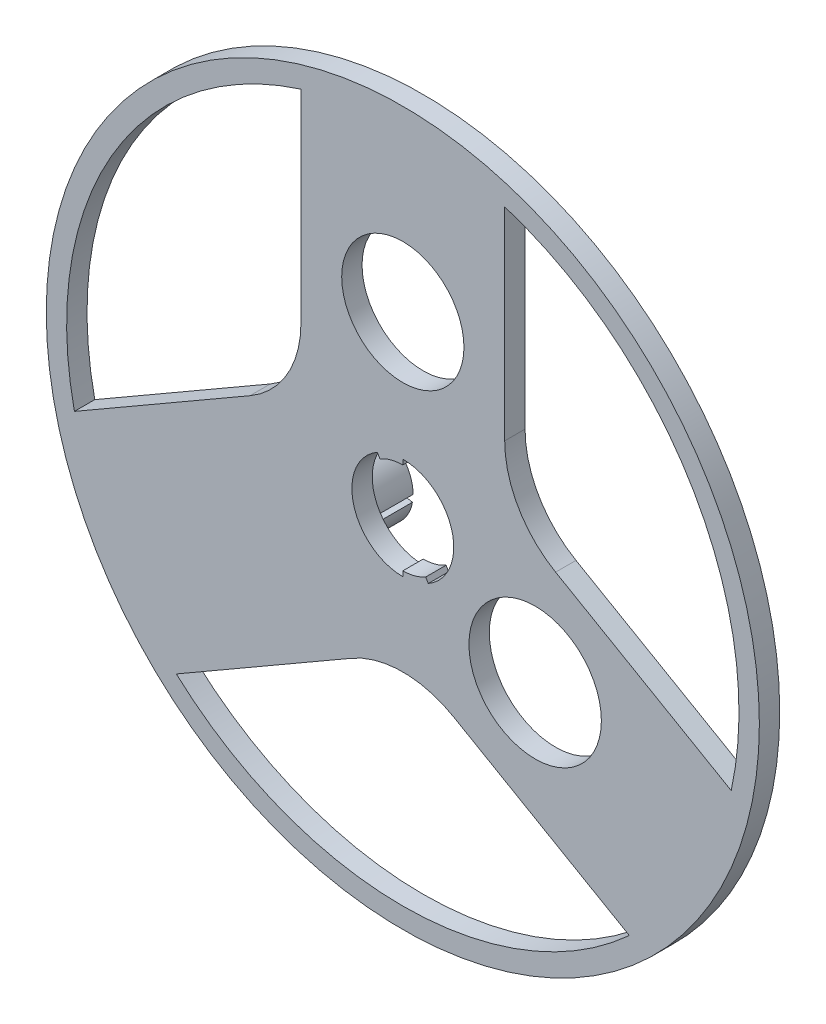
from build123d import *

# Parameters (mm, degrees)
SKETCH1_R           = 35
BOSS_EXTRUDE1_DEPTH = 2
FILLET1_R           = 10
CUT_EXTRUDE2_REACH  = 51.538
CUT_EXTRUDE3_REACH  = 51.538
SKETCH3_R           = 6
SKETCH3_R_2         = 6.5
BOSS_EXTRUDE2_DEPTH = 8
CHAMFER1_SIZE       = 1


with BuildPart() as part:
    # Sketch1 → Boss-Extrude1 (new body)
    with BuildSketch(Plane.XY):
        Circle(SKETCH1_R)
        with BuildLine():
            Line((-10, 31.448370387), (-10, 5.773502692))
            Line((-10, 5.773502692), (-32.235087663, -7.063931156))
            ThreePointArc((-32.235087663, -7.063931156), (-28.578838325, 16.5), (-10, 31.448370387))
        make_face(mode=Mode.SUBTRACT)
        with BuildLine():
            Line((-22.235087663, -24.384439231), (0, -11.547005384))
            Line((0, -11.547005384), (22.235087663, -24.384439231))
            ThreePointArc((22.235087663, -24.384439231), (0, -33), (-22.235087663, -24.384439231))
        make_face(mode=Mode.SUBTRACT)
        with BuildLine():
            ThreePointArc((10, 31.448370387), (28.578838325, 16.5), (32.235087663, -7.063931156))
            Line((32.235087663, -7.063931156), (10, 5.773502692))
            Line((10, 5.773502692), (10, 31.448370387))
        make_face(mode=Mode.SUBTRACT)
    extrude(amount=BOSS_EXTRUDE1_DEPTH)

    # Fillet1
    fillet1_edges = [part.edges().sort_by_distance(p)[0] for p in [
        (10, 5.773502692, 1),
        (0, -11.547005384, 1),
        (-10, 5.773502692, 1),
    ]]
    fillet(fillet1_edges, radius=FILLET1_R)

    # Sketch2 → Cut-Extrude2 (cut, up to next)
    with BuildSketch(Plane(origin=(0, 0, 0), x_dir=(-1, 0, 0), z_dir=(0, 0, -1)), mode=Mode.PRIVATE) as cut_extrude2_sk1:
        with BuildLine():
            Line((0, 4.5), (0, 5))
            ThreePointArc((0, 5), (-4.829629131, 1.294095226), (-2.5, -4.330127019))
            Line((-2.5, -4.330127019), (-2.25, -3.897114317))
            ThreePointArc((-2.25, -3.897114317), (-1.164685703, -4.346666218), (0, -4.5))
            Line((0, -4.5), (0, -5))
            ThreePointArc((0, -5), (4.829629131, -1.294095226), (2.5, 4.330127019))
            Line((2.5, 4.330127019), (2.25, 3.897114317))
            ThreePointArc((2.25, 3.897114317), (1.164685703, 4.346666218), (0, 4.5))
        make_face()
    cut_extrude2_tool1 = extrude(cut_extrude2_sk1.sketch, amount=-CUT_EXTRUDE2_REACH, mode=Mode.PRIVATE) & part.part
    add(cut_extrude2_tool1.solids().sort_by_distance((0, 0, 0))[0], mode=Mode.SUBTRACT)

    # Sketch3 → Cut-Extrude3 (cut, up to next)
    with BuildSketch(Plane(origin=(0, 0, 0), x_dir=(-1, 0, 0), z_dir=(0, 0, -1)), mode=Mode.PRIVATE) as cut_extrude3_sk1:
        with Locations((0, 17.5)):
            Circle(SKETCH3_R)
    cut_extrude3_tool1 = extrude(cut_extrude3_sk1.sketch, amount=-CUT_EXTRUDE3_REACH, mode=Mode.PRIVATE) & part.part
    # Sketch3 → Cut-Extrude3 (cut, up to next)
    with BuildSketch(Plane(origin=(0, 0, 0), x_dir=(-1, 0, 0), z_dir=(0, 0, -1)), mode=Mode.PRIVATE) as cut_extrude3_sk2:
        with Locations((-12.990381057, -7.5)):
            Circle(SKETCH3_R_2)
    cut_extrude3_tool2 = extrude(cut_extrude3_sk2.sketch, amount=-CUT_EXTRUDE3_REACH, mode=Mode.PRIVATE) & part.part
    add(cut_extrude3_tool1.solids().sort_by_distance((0, 17.5, 0))[0], mode=Mode.SUBTRACT)
    add(cut_extrude3_tool2.solids().sort_by_distance((12.990381, -7.5, 0))[0], mode=Mode.SUBTRACT)

    # Sketch3<4> → Boss-Extrude2 (add)
    with BuildSketch(Plane(origin=(0, 0, 0), x_dir=(-1, 0, 0), z_dir=(0, 0, -1))):
        with BuildLine():
            Line((12.990381057, -3.5), (12.990381057, -4.2))
            ThreePointArc((12.990381057, -4.2), (15.111580169, -4.972053338), (16.240246642, -6.926961014))
            Line((16.240246642, -6.926961014), (16.929612069, -6.805407289))
            ThreePointArc((16.929612069, -6.805407289), (15.561531496, -4.435822228), (12.990381057, -3.5))
        make_face()
        with BuildLine():
            ThreePointArc((16.290381057, -7.5), (15.518327719, -9.621199112), (13.563420043, -10.749865585))
            Line((13.563420043, -10.749865585), (13.684973767, -11.439231012))
            ThreePointArc((13.684973767, -11.439231012), (16.054558829, -10.071150439), (16.990381057, -7.5))
            Line((16.990381057, -7.5), (16.290381057, -7.5))
        make_face()
        with BuildLine():
            ThreePointArc((12.990381057, -10.8), (10.869181945, -10.027946662), (9.740515472, -8.073038986))
            Line((9.740515472, -8.073038986), (9.051150045, -8.194592711))
            ThreePointArc((9.051150045, -8.194592711), (10.419230618, -10.564177772), (12.990381057, -11.5))
            Line((12.990381057, -11.5), (12.990381057, -10.8))
        make_face()
        with BuildLine():
            ThreePointArc((9.690381057, -7.5), (10.462434394, -5.378800888), (12.41734207, -4.250134415))
            Line((12.41734207, -4.250134415), (12.295788346, -3.560768988))
            ThreePointArc((12.295788346, -3.560768988), (9.926203284, -4.928849561), (8.990381057, -7.5))
            Line((8.990381057, -7.5), (9.690381057, -7.5))
        make_face()
    extrude(amount=BOSS_EXTRUDE2_DEPTH)

    # Chamfer1
    chamfer1_edges = [part.edges().sort_by_distance(p)[0] for p in [
        (-15.561531496, -4.435822228, 0),
        (-9.926203284, -4.928849561, 0),
        (-10.419230618, -10.564177772, 0),
        (-16.054558829, -10.071150439, 0),
    ]]
    chamfer(chamfer1_edges, length=CHAMFER1_SIZE)


solid = part.part
